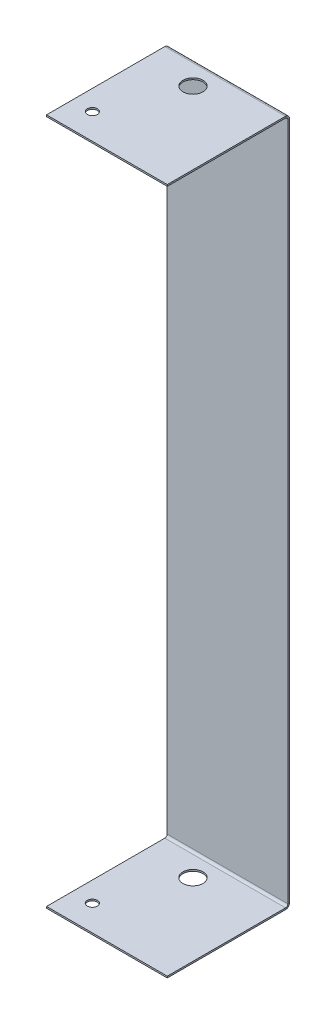
from build123d import *

# Parameters (mm, degrees)
SKETCH1_W                        = 38.1
SKETCH1_H                        = 292.1
BASE_FLANGE1_DEPTH               = 0.508
SKETCHED_START                   = -19.05
SKETCHED_BEND5_DEPTH             = 38.1
SKETCHED_BEND5_2_DEPTH           = 38.1
SKETCHED_BEND8_DEPTH             = 38.1
SKETCHED_BEND8_2_DEPTH           = 38.1
F_1_4_0_25_DIAMETER_HOLE4_D      = 6.35
F_1_4_0_25_DIAMETER_HOLE4_DEPTH  = 0.508
F_1_8_0_125_DIAMETER_HOLE1_D     = 3.175
F_1_8_0_125_DIAMETER_HOLE1_DEPTH = 0.508


# Read off the part's stored shape, not the designer's step: Sketched Bend5, Sketched Bend8
# Sheet-metal steps are written as plain solids
with BuildPart() as part:
    # Sketch1 → Base-Flange1 (new body)
    with BuildSketch(Plane.XY):
        Rectangle(SKETCH1_W, SKETCH1_H)
    extrude(amount=-BASE_FLANGE1_DEPTH)

    # Sketched Bend5 outline → Sketched Bend5 (cut)
    with BuildSketch(Plane.YZ.offset(SKETCHED_START)):
        with BuildLine():
            Line((146.05, 0), (108.175204196, 0))
            ThreePointArc((108.175204196, 0), (107.734237547, -0.373760644), (107.171984579, -0.508))
            Line((107.171984579, -0.508), (146.05, -0.508))
            Line((146.05, -0.508), (146.05, 0))
        make_face()
    extrude(amount=SKETCHED_BEND5_DEPTH, mode=Mode.SUBTRACT)

    # Sketched Bend5 2 outline → Sketched Bend5 2 (add)
    with BuildSketch(Plane.YZ.offset(SKETCHED_START)):
        with BuildLine():
            ThreePointArc((108.175204196, 0), (108.354701007, 0.349029345), (108.416584579, 0.7366))
            Line((108.416584579, 0.7366), (108.416584579, 38.058584579))
            Line((108.416584579, 38.058584579), (107.908584579, 38.058584579))
            Line((107.908584579, 38.058584579), (107.908584579, 0.7366))
            ThreePointArc((107.908584579, 0.7366), (107.692839434, 0.215745145), (107.171984579, 0))
            Line((107.171984579, 0), (108.175204196, 0))
        make_face()
    extrude(amount=SKETCHED_BEND5_2_DEPTH)

    # Sketched Bend8 outline → Sketched Bend8 (cut)
    with BuildSketch(Plane.YZ.offset(SKETCHED_START)):
        with BuildLine():
            ThreePointArc((-107.171984579, -0.508), (-107.734237547, -0.373760644), (-108.175204196, 0))
            Line((-108.175204196, 0), (-146.05, 0))
            Line((-146.05, 0), (-146.05, -0.508))
            Line((-146.05, -0.508), (-107.171984579, -0.508))
        make_face()
    extrude(amount=SKETCHED_BEND8_DEPTH, mode=Mode.SUBTRACT)

    # Sketched Bend8 2 outline → Sketched Bend8 2 (add)
    with BuildSketch(Plane.YZ.offset(SKETCHED_START)):
        with BuildLine():
            Line((-107.908584579, 0.7366), (-107.908584579, 38.058584579))
            Line((-107.908584579, 38.058584579), (-108.416584579, 38.058584579))
            Line((-108.416584579, 38.058584579), (-108.416584579, 0.7366))
            ThreePointArc((-108.416584579, 0.7366), (-108.354701007, 0.349029345), (-108.175204196, 0))
            Line((-108.175204196, 0), (-107.171984579, 0))
            ThreePointArc((-107.171984579, 0), (-107.692839434, 0.215745145), (-107.908584579, 0.7366))
        make_face()
    extrude(amount=SKETCHED_BEND8_2_DEPTH)

    # 1/4 (0.25) Diameter Hole4
    with Locations(Plane(origin=(-3.81, 107.908584579, 7.0866), x_dir=(0, 0, -1), z_dir=(0, -1, 0))):
        with Locations((0, 0)):
            f_1_4_0_25_diameter_hole4 = Hole(F_1_4_0_25_DIAMETER_HOLE4_D / 2, depth=F_1_4_0_25_DIAMETER_HOLE4_DEPTH)

    # 1/8 (0.125) Diameter Hole1
    with Locations(Plane(origin=(-12.7, 107.908584579, 29.9466), x_dir=(0, 0, -1), z_dir=(0, -1, 0))):
        with Locations((0, 0)):
            f_1_8_0_125_diameter_hole1 = Hole(F_1_8_0_125_DIAMETER_HOLE1_D / 2, depth=F_1_8_0_125_DIAMETER_HOLE1_DEPTH)

    # Mirror1: 1/4 (0.25) Diameter Hole4, 1/8 (0.125) Diameter Hole1 across plane
    add(f_1_4_0_25_diameter_hole4.mirror(Plane.ZX), mode=Mode.SUBTRACT)
    add(f_1_8_0_125_diameter_hole1.mirror(Plane.ZX), mode=Mode.SUBTRACT)


solid = part.part
